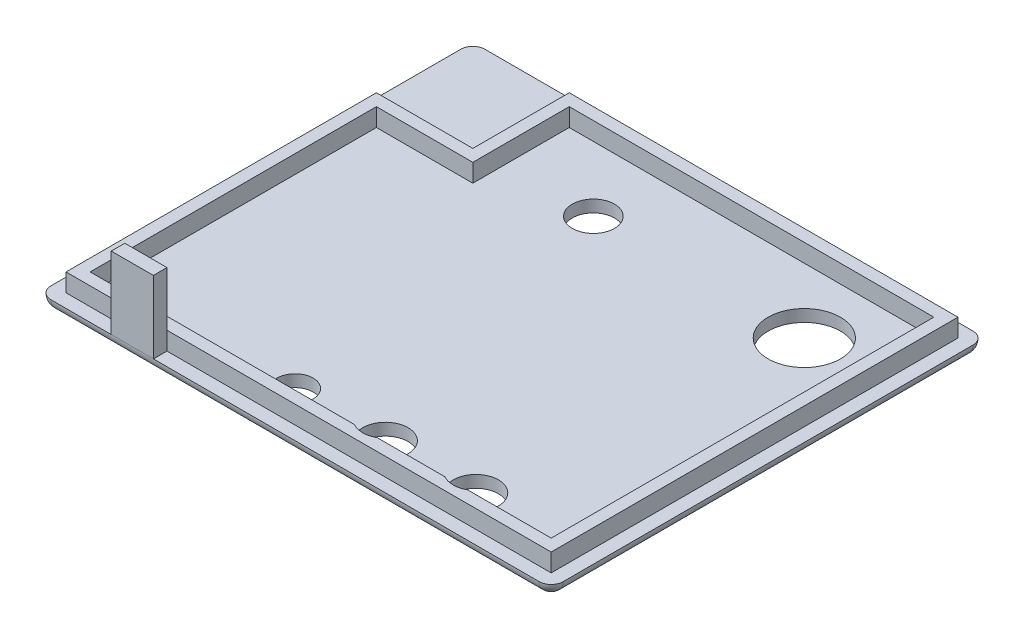
from build123d import *

# Parameters (mm, degrees)
ESQUISSE1_W             = 85
ESQUISSE1_H             = 72
BOSS_EXTRU_1_DEPTH      = 2
BOSS_EXTRU_2_DEPTH      = 3
ESQUISSE3_R             = 3.75
ESQUISSE3_R_2           = 3
ENL_V_MAT_EXTRU_1_DEPTH = 56.921820428
ESQUISSE4_R             = 6
ESQUISSE4_R_2           = 3.5
ENL_V_MAT_EXTRU_2_DEPTH = 2
ESQUISSE8_W             = 7
ESQUISSE8_H             = 2.25
BOSS_EXTRU_4_DEPTH      = 12
CONG_4_R                = 2


with BuildPart() as part:
    # Esquisse1 → Boss.-Extru.1 (new body)
    with BuildSketch(Plane(origin=(0, 0, 0), x_dir=(1, 0, 0), z_dir=(0, 1, 0))):
        Rectangle(ESQUISSE1_W, ESQUISSE1_H)
    extrude(amount=BOSS_EXTRU_1_DEPTH)

    # Esquisse2 → Boss.-Extru.2 (add)
    with BuildSketch(Plane(origin=(0, 2, 0), x_dir=(1, 0, 0), z_dir=(0, 1, 0))):
        Polygon((40.25, -33.75), (-40.25, -33.75), (-40.25, 17.75), (-24.25, 17.75), (-24.25, 33.75), (40.25, 33.75), align=None)
        Polygon((-38.25, -31.75), (38.25, -31.75), (38.25, 31.75), (-22.25, 31.75), (-22.25, 15.75), (-38.25, 15.75), align=None, mode=Mode.SUBTRACT)
    extrude(amount=BOSS_EXTRU_2_DEPTH)

    # Esquisse3 → Enlèv. mat.-Extru.1 (cut, through all)
    with BuildSketch(Plane(origin=(0, 0, 0), x_dir=(-1, 0, 0), z_dir=(0, -1, 0))):
        with Locations(Location((-22.5, -28.5, 0), (0, 0, 90))):
            Circle(ESQUISSE3_R)
        with Locations(Location((-7.5, -28.5, 0), (0, 0, 90))):
            Circle(ESQUISSE3_R)
        with Locations(Location((7.5, -28.5, 0), (0, 0, 90))):
            Circle(ESQUISSE3_R_2)
    extrude(amount=-ENL_V_MAT_EXTRU_1_DEPTH, mode=Mode.SUBTRACT)

    # Esquisse4 → Enlèv. mat.-Extru.2 (cut)
    with BuildSketch(Plane(origin=(0, 0, 0), x_dir=(-1, 0, 0), z_dir=(0, -1, 0))):
        with Locations(Location((-27.5, 21, 0), (0, 0, 90))):
            Circle(ESQUISSE4_R)
        with Locations(Location((7.5, 21, 0), (0, 0, 90))):
            Circle(ESQUISSE4_R_2)
    extrude(amount=-ENL_V_MAT_EXTRU_2_DEPTH, mode=Mode.SUBTRACT)

    # Esquisse8 → Boss.-Extru.4 (add)
    with BuildSketch(Plane(origin=(0, 2, 0), x_dir=(1, 0, 0), z_dir=(0, 1, 0))):
        with Locations((-27, -34.875)):
            Rectangle(ESQUISSE8_W, ESQUISSE8_H)
    extrude(amount=BOSS_EXTRU_4_DEPTH)

    # Congé4
    cong_4_edges = [part.edges().sort_by_distance(p)[0] for p in [
        (0, 0, -36),
        (42.5, 0, 0),
        (0, 0, 36),
        (-42.5, 0, 0),
        (-42.5, 1, -36),
        (42.5, 1, -36),
        (42.5, 1, 36),
        (-42.5, 1, 36),
    ]]
    fillet(cong_4_edges, radius=CONG_4_R - 0.0001)  # a hair under: the kernel refuses the full size


solid = part.part
